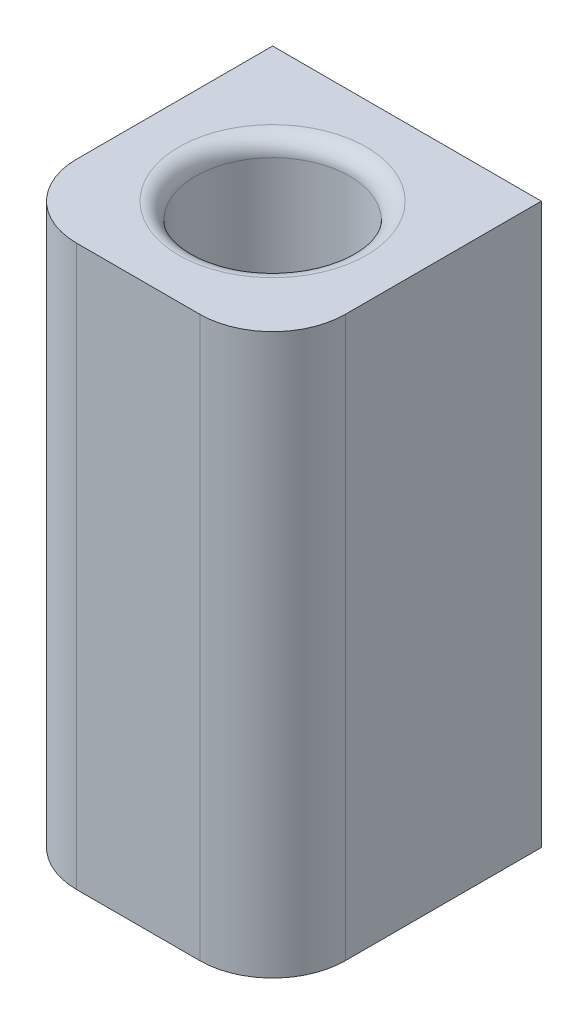
from build123d import *

# Parameters (mm, degrees)
SKETCH1_R           = 13.75
BOSS_EXTRUDE1_DEPTH = 100
FILLET1_R           = 13
FILLET2_R           = 3


with BuildPart() as part:
    # Sketch1 → Boss-Extrude1 (new body)
    with BuildSketch(Plane(origin=(0, 0, 0), x_dir=(1, 0, 0), z_dir=(0, 1, 0))):
        Polygon((0, 29.837240524), (-24, 29.837240524), (-24, -18.162759476), (24, -18.162759476), (24, 29.837240524), align=None)
        with Locations((0, 5.837240524)):
            Circle(SKETCH1_R, mode=Mode.SUBTRACT)
    extrude(amount=BOSS_EXTRUDE1_DEPTH)

    # Fillet1
    fillet1_edges = [part.edges().sort_by_distance(p)[0] for p in [
        (-24, 50, 18.162759476),
        (24, 50, 18.162759476),
    ]]
    fillet(fillet1_edges, radius=FILLET1_R)

    # Fillet2
    fillet2_edges = [part.edges().sort_by_distance(p)[0] for p in [
        (-13.75, 0, -5.837240524),
        (-13.75, 100, -5.837240524),
    ]]
    fillet(fillet2_edges, radius=FILLET2_R)


solid = part.part
